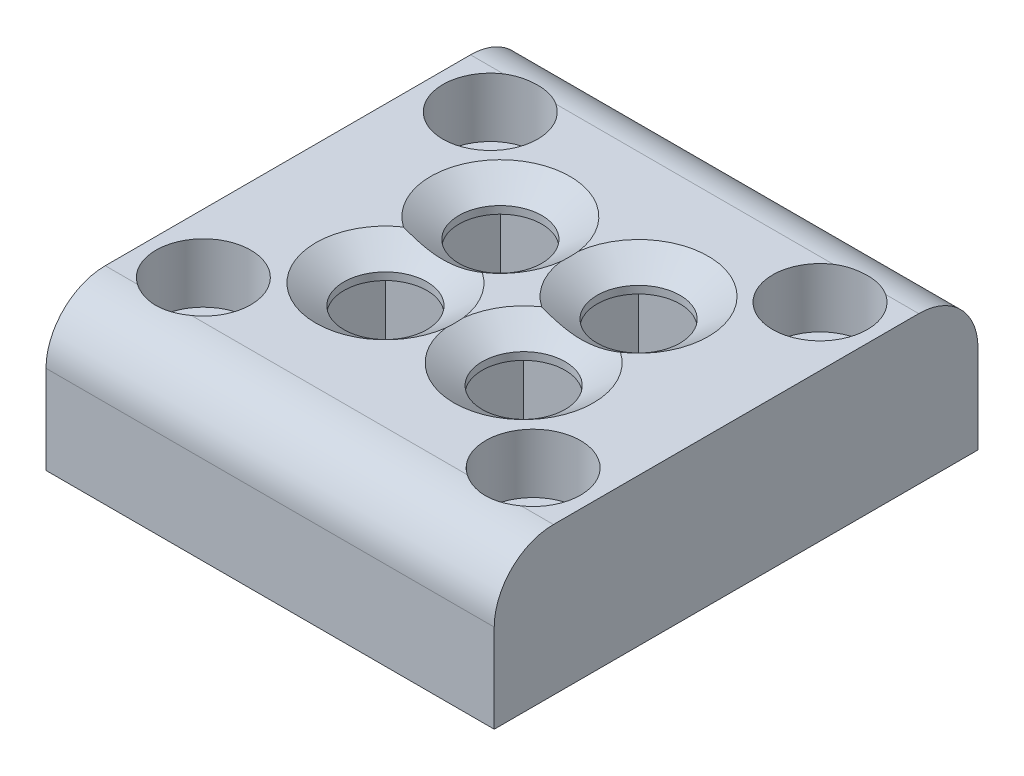
from build123d import *

# Parameters (mm, degrees)
BOSS_EXTRUDE1_DEPTH = 22.7
SKETCH2_R           = 2.1
CUT_EXTRUDE1_DEPTH  = 22.7
SKETCH4_W           = 4.5
SKETCH4_H           = 4.5
CUT_EXTRUDE2_DEPTH  = 6.1
SKETCH7_R           = 1.5
CUT_EXTRUDE3_DEPTH  = 13
SKETCH9_R           = 2.4
CUT_EXTRUDE4_DEPTH  = 3
FILLET1_R           = 3
CHAMFER2_SIZE       = 1.428148007
CHAMFER2_SIZE_2     = 1


with BuildPart() as part:
    # Sketch1 → Boss-Extrude1 (new body)
    with BuildSketch(Plane(origin=(0, 0, 0), x_dir=(0, 0, -1), z_dir=(1, 0, 0))):
        Polygon((-12.25, -146.25), (12.25, -146.25), (12.25, -140.25), (12.25, -138.77), (2.91, -138.77), (-2.91, -138.77), (-12.25, -138.77), (-12.25, -140.25), align=None)
    extrude(amount=BOSS_EXTRUDE1_DEPTH)

    # Sketch2 → Cut-Extrude1 (cut)
    with BuildSketch(Plane(origin=(0, -138.77, 0), x_dir=(1, 0, 0), z_dir=(0, 1, 0))):
        with Locations(Location((14.85, 2.91, 0), (0, 0, 270))):
            Circle(SKETCH2_R)
        with Locations(Location((7.85, 2.91, 0), (0, 0, 270))):
            Circle(SKETCH2_R)
        with Locations(Location((14.85, -2.91, 0), (0, 0, 270))):
            Circle(SKETCH2_R)
        with Locations(Location((7.85, -2.91, 0), (0, 0, 270))):
            Circle(SKETCH2_R)
    extrude(amount=-CUT_EXTRUDE1_DEPTH, mode=Mode.SUBTRACT)

    # Sketch4 → Cut-Extrude2 (cut)
    with BuildSketch(Plane.XZ.offset(146.25)):
        with Locations((7.85, 2.91)):
            Rectangle(SKETCH4_W, SKETCH4_H)
        with Locations((14.85, 2.91)):
            Rectangle(SKETCH4_W, SKETCH4_H)
        with Locations((14.85, -2.91)):
            Rectangle(SKETCH4_W, SKETCH4_H)
        with Locations((7.85, -2.91)):
            Rectangle(SKETCH4_W, SKETCH4_H)
    extrude(amount=-CUT_EXTRUDE2_DEPTH, mode=Mode.SUBTRACT)

    # Sketch7 → Cut-Extrude3 (cut)
    with BuildSketch(Plane(origin=(0, -138.77, 0), x_dir=(-1, 0, 0), z_dir=(0, -1, 0))):
        with Locations(Location((-3, -7.28, 0), (0, 0, 270))):
            Circle(SKETCH7_R)
        with Locations(Location((-19.7, -7.28, 0), (0, 0, 270))):
            Circle(SKETCH7_R)
        with Locations(Location((-19.7, 7.25, 0), (0, 0, 270))):
            Circle(SKETCH7_R)
        with Locations(Location((-3, 7.25, 0), (0, 0, 270))):
            Circle(SKETCH7_R)
    extrude(amount=CUT_EXTRUDE3_DEPTH, mode=Mode.SUBTRACT)

    # Sketch9 → Cut-Extrude4 (cut)
    with BuildSketch(Plane(origin=(0, -138.77, 0), x_dir=(1, 0, 0), z_dir=(0, 1, 0))):
        with Locations(Location((3, 7.25, 0), (0, 0, 270))):
            Circle(SKETCH9_R)
        with Locations(Location((19.7, 7.25, 0), (0, 0, 270))):
            Circle(SKETCH9_R)
        with Locations(Location((19.7, -7.28, 0), (0, 0, 270))):
            Circle(SKETCH9_R)
        with Locations(Location((3, -7.28, 0), (0, 0, 270))):
            Circle(SKETCH9_R)
    extrude(amount=-CUT_EXTRUDE4_DEPTH, mode=Mode.SUBTRACT)

    # Fillet1
    # the kernel refuses this fillet: 3 mm, written as the material it takes off along each edge
    with BuildSketch(Plane(origin=(-7.5, -138.77, 12.25), x_dir=(0, -1, 0), z_dir=(1, 0, 0))) as fillet1_piece_1:
        with BuildLine():
            CenterArc((FILLET1_R, FILLET1_R), FILLET1_R, 180, 90)
            Line((0, FILLET1_R), (0, 0))
            Line((0, 0), (FILLET1_R, 0))
        make_face()
    extrude(amount=37.7, mode=Mode.SUBTRACT)
    with BuildSketch(Plane(origin=(-7.5, -138.77, -12.25), x_dir=(0, -1, 0), z_dir=(1, 0, 0))) as fillet1_piece_2:
        with BuildLine():
            CenterArc((FILLET1_R, -FILLET1_R), FILLET1_R, 90, 90)
            Line((0, -FILLET1_R), (0, 0))
            Line((0, 0), (FILLET1_R, 0))
        make_face()
    extrude(amount=37.7, mode=Mode.SUBTRACT)

    # Chamfer2
    # the kernel refuses this chamfer: 1.428148007, 1 mm, written as the material it takes off along each edge
    with BuildSketch(Plane(origin=(7.85, -138.77, 2.91), x_dir=(0, 0, 1), z_dir=(-1, 0, 0))) as chamfer2_piece_1:
        Polygon((2.1 + CHAMFER2_SIZE, 0), (2.1, -CHAMFER2_SIZE_2), (2.1, 0), align=None)
    revolve(axis=Axis((7.85, -138.77, 2.91), (0, 1, 0)), mode=Mode.SUBTRACT)
    with BuildSketch(Plane(origin=(7.85, -138.77, -2.91), x_dir=(0, 0, 1), z_dir=(-1, 0, 0))) as chamfer2_piece_2:
        Polygon((2.1 + CHAMFER2_SIZE, 0), (2.1, -CHAMFER2_SIZE_2), (2.1, 0), align=None)
    revolve(axis=Axis((7.85, -138.77, -2.91), (0, 1, 0)), mode=Mode.SUBTRACT)
    with BuildSketch(Plane(origin=(14.85, -138.77, -2.91), x_dir=(0, 0, 1), z_dir=(-1, 0, 0))) as chamfer2_piece_3:
        Polygon((2.1 + CHAMFER2_SIZE, 0), (2.1, -CHAMFER2_SIZE_2), (2.1, 0), align=None)
    revolve(axis=Axis((14.85, -138.77, -2.91), (0, 1, 0)), mode=Mode.SUBTRACT)
    with BuildSketch(Plane(origin=(14.85, -138.77, 2.91), x_dir=(0, 0, 1), z_dir=(-1, 0, 0))) as chamfer2_piece_4:
        Polygon((2.1 + CHAMFER2_SIZE, 0), (2.1, -CHAMFER2_SIZE_2), (2.1, 0), align=None)
    revolve(axis=Axis((14.85, -138.77, 2.91), (0, 1, 0)), mode=Mode.SUBTRACT)


solid = part.part
